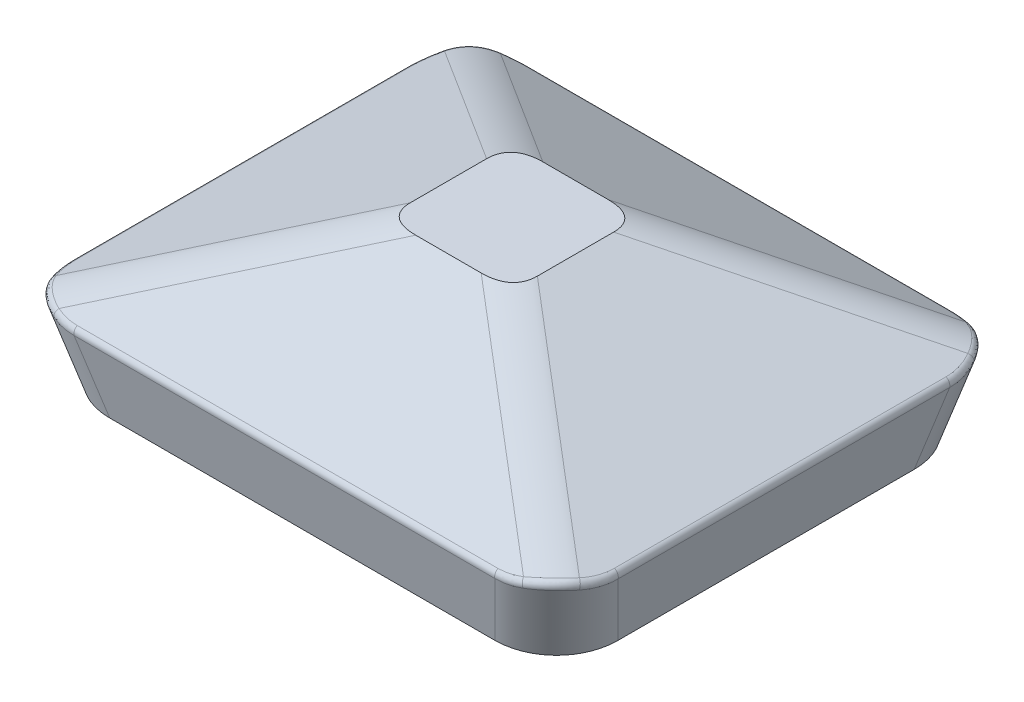
from build123d import *

# Parameters (mm, degrees)
BOSS_EXTRUDE1_DEPTH     = 72
CUT_EXTRUDE1_DEPTH      = 88.800911157
CUT_EXTRUDE1_DEPTH_BACK = 88.800911157
SKETCH3_OUTSIDE_W       = 97.026
SKETCH3_OUTSIDE_H       = 51.026
FILLET1_R               = 10
FILLET2_R               = 1


with BuildPart() as part:
    # Sketch2 → Boss-Extrude1 (new body)
    with BuildSketch(Plane.XY):
        Polygon((40, 0), (-40, 0), (-43, 12), (-10, 26), (10, 26), (43, 12), align=None)
    extrude(amount=BOSS_EXTRUDE1_DEPTH)

    # Sketch3 outside → Cut-Extrude1 (cut, two sides: drawn at the far end of the back side and taken through both)
    with BuildSketch(Plane(origin=(0, 0, 0), x_dir=(0, 0, -1), z_dir=(1, 0, 0)).offset(-CUT_EXTRUDE1_DEPTH_BACK)):
        with Locations((-36, 13)):
            Rectangle(SKETCH3_OUTSIDE_W, SKETCH3_OUTSIDE_H)
        Polygon((-3, 0), (-69, 0), (-72, 12), (-46, 26), (-26, 26), (0, 12), align=None, mode=Mode.SUBTRACT)
    extrude(amount=CUT_EXTRUDE1_DEPTH + CUT_EXTRUDE1_DEPTH_BACK, mode=Mode.SUBTRACT)

    # Fillet1
    # the kernel refuses this fillet: 10 mm, written as the material it takes off along each edge
    with BuildSketch(Plane(origin=(-34.444444444, -22.222222222, 63.444444444), x_dir=(-0.05716619504750304, 0.22866478019001177, -0.97182531580755), z_dir=(-0.2357022603955158, 0.9428090415820634, 0.23570226039551584))) as fillet1_piece_1:
        with BuildLine():
            CenterArc((FILLET1_R * 0.942809041582, -FILLET1_R), FILLET1_R, 90, 86.627713317)
            Line((-FILLET1_R * 0.0554593553872, -FILLET1_R * 0.941176470588), (0, 0))
            Line((0, 0), (FILLET1_R * 0.942809041582, 0))
        make_face()
    extrude(amount=59.86837414, mode=Mode.SUBTRACT)
    with BuildSketch(Plane(origin=(3.973534182, 28.556682468, 41.251875416), x_dir=(-0.6668366263040146, -0.35330105659685085, 0.6561305336798682), z_dir=(0.7452039410922892, -0.31614712652400145, 0.5871303778302884)), Plane(origin=(49.026465818, 9.443317532, -4.748124584), x_dir=(-0.6668366263040147, -0.3533010565968522, -0.6561305336798673), z_dir=(-0.7452039410922889, 0.31614712652400134, 0.5871303778302885)), Plane(origin=(-3.973534182, 28.556682468, 30.748124584), x_dir=(0.6668366263040149, -0.3533010565968514, -0.6561305336798677), z_dir=(-0.7452039410922889, -0.31614712652400134, -0.5871303778302885))) as fillet1_piece_2:
        with BuildLine():
            CenterArc((FILLET1_R * 0.323480083029, FILLET1_R), FILLET1_R, 234.149277599, 35.850722401)
            Line((-FILLET1_R * 0.262195375473, FILLET1_R * 0.189454345944), (0, 0))
            Line((0, 0), (FILLET1_R * 0.323480083029, 0))
        make_face()
    extrude(amount=60.457183802, mode=Mode.SUBTRACT)
    with BuildSketch(Plane(origin=(-48.555555556, 34.222222222, -5.555555556), x_dir=(0.97182531580755, 0.22866478019001185, -0.057166195047502776), z_dir=(0.23570226039551587, -0.9428090415820636, 0.23570226039551517)), Plane(origin=(48.555555556, 34.222222222, 77.555555556), x_dir=(-0.97182531580755, 0.22866478019001168, 0.05716619504750348), z_dir=(-0.2357022603955158, -0.9428090415820634, -0.23570226039551584)), Plane(origin=(34.444444444, -22.222222222, 8.555555556), x_dir=(-0.97182531580755, 0.22866478019001185, -0.057166195047502776), z_dir=(0.23570226039551587, 0.9428090415820636, -0.23570226039551517))) as fillet1_piece_3:
        with BuildLine():
            CenterArc((FILLET1_R * 0.942809041582, FILLET1_R), FILLET1_R, 183.372286683, 86.627713317)
            Line((-FILLET1_R * 0.0554593553872, FILLET1_R * 0.941176470588), (0, 0))
            Line((0, 0), (FILLET1_R * 0.942809041582, 0))
        make_face()
    extrude(amount=59.86837414, mode=Mode.SUBTRACT)
    with BuildSketch(Plane(origin=(-49.026465818, 9.443317532, 76.748124584), x_dir=(-0.5405015294160996, -0.22930367914622402, -0.80949238379917), z_dir=(0.7452039410922892, 0.31614712652400145, -0.5871303778302884))) as fillet1_piece_4:
        with BuildLine():
            CenterArc((FILLET1_R * 0.323480083029, -FILLET1_R), FILLET1_R, 90, 35.850722401)
            Line((-FILLET1_R * 0.262195375473, -FILLET1_R * 0.189454345944), (0, 0))
            Line((0, 0), (FILLET1_R * 0.323480083029, 0))
        make_face()
    extrude(amount=60.457183802, mode=Mode.SUBTRACT)

    # Fillet2
    fillet2_edges = [part.edges().sort_by_distance(p)[0] for p in [
        (40.017878955, 12.71151673, 2.295346379),
        (-40.017878955, 12.71151673, 2.295346379),
        (0, 12, 72),
        (-35.324368882, 12.09460177, 71.824310998),
        (35.324368882, 12.09460177, 71.824310998),
        (43, 12, 36),
        (42.724154161, 12.117025507, 7.20509793),
        (42.724154161, 12.117025507, 64.79490207),
        (-43, 12, 36),
        (-42.724154161, 12.117025507, 7.20509793),
        (-42.724154161, 12.117025507, 64.79490207),
        (0, 12, 0),
        (-35.324368882, 12.09460177, 0.175689002),
        (35.324368882, 12.09460177, 0.175689002),
        (40.017878955, 12.71151673, 69.704653621),
        (-40.017878955, 12.71151673, 69.704653621),
    ]]
    fillet(fillet2_edges, radius=FILLET2_R)


solid = part.part
